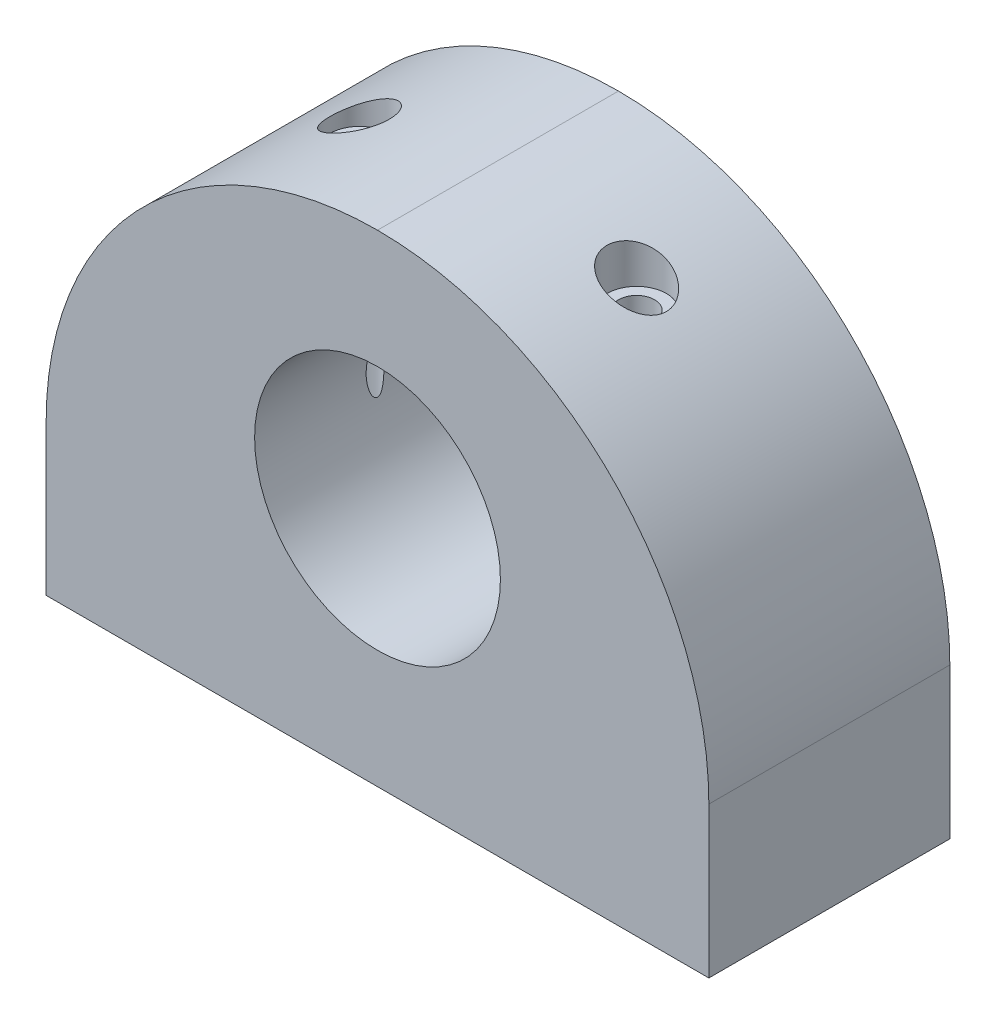
from build123d import *

# Parameters (mm, degrees)
SKETCH1_W              = 55
SKETCH1_H              = 20
BOSS_EXTRUDE2_DEPTH    = 40
FILLET3_R              = 27.5
SKETCH3_R              = 10.2
CUT_EXTRUDE1_DEPTH     = 40
SKETCH4_R              = 1.5
CUT_EXTRUDE2_DEPTH     = 40
CUT_EXTRUDE3_OUTLINE_W = 1.013964341
CUT_EXTRUDE3_OUTLINE_H = 3.461369181
CUT_EXTRUDE4_OUTLINE_W = 1.011767624
CUT_EXTRUDE4_OUTLINE_H = 3.485879142


# Read off the part's stored shape, not the designer's step: Cut-Extrude3, Cut-Extrude4
with BuildPart() as part:
    # Sketch1 → Boss-Extrude2 (new body)
    with BuildSketch(Plane(origin=(0, 0, 0), x_dir=(1, 0, 0), z_dir=(0, 1, 0))):
        Rectangle(SKETCH1_W, SKETCH1_H)
    extrude(amount=BOSS_EXTRUDE2_DEPTH)

    # Fillet3
    fillet3_edges = [part.edges().sort_by_distance(p)[0] for p in [
        (27.5, 40, 0),
        (-27.5, 40, 0),
    ]]
    fillet(fillet3_edges, radius=FILLET3_R - 0.0001)  # a hair under: the kernel refuses the full size

    # Sketch3 → Cut-Extrude1 (cut)
    with BuildSketch(Plane(origin=(0, 0, -10), x_dir=(-1, 0, 0), z_dir=(0, 0, -1))):
        with Locations((0, 20)):
            Circle(SKETCH3_R)
    extrude(amount=-CUT_EXTRUDE1_DEPTH, mode=Mode.SUBTRACT)

    # Sketch4 → Cut-Extrude2 (cut)
    with BuildSketch(Plane.XZ):
        with Locations(Location((-11.5, 0, 0), (0, 0, 270))):
            Circle(SKETCH4_R)
        with Locations(Location((11.5, 0, 0), (0, 0, 270))):
            Circle(SKETCH4_R)
    extrude(amount=-CUT_EXTRUDE2_DEPTH, mode=Mode.SUBTRACT)

    # Cut-Extrude3 outline → Cut-Extrude3 (revolve, cut)
    with BuildSketch(Plane(origin=(11.536337156, 0, 0.030463059), x_dir=(1, 0, 0), z_dir=(0, 0, 1))):
        with Locations((1.959565013, 36.730684591)):
            Rectangle(CUT_EXTRUDE3_OUTLINE_W, CUT_EXTRUDE3_OUTLINE_H)
    revolve(axis=Axis((11.536337156, 0, 0.030463059), (0, 1, 0)), mode=Mode.SUBTRACT)

    # Cut-Extrude4 outline → Cut-Extrude4 (revolve, cut)
    with BuildSketch(Plane(origin=(-11.463662844, 0, 0.030463059), x_dir=(1, 0, 0), z_dir=(0, 0, 1))):
        with Locations((1.958466654, 36.742939571)):
            Rectangle(CUT_EXTRUDE4_OUTLINE_W, CUT_EXTRUDE4_OUTLINE_H)
    revolve(axis=Axis((-11.463662844, 0, 0.030463059), (0, 1, 0)), mode=Mode.SUBTRACT)


solid = part.part
